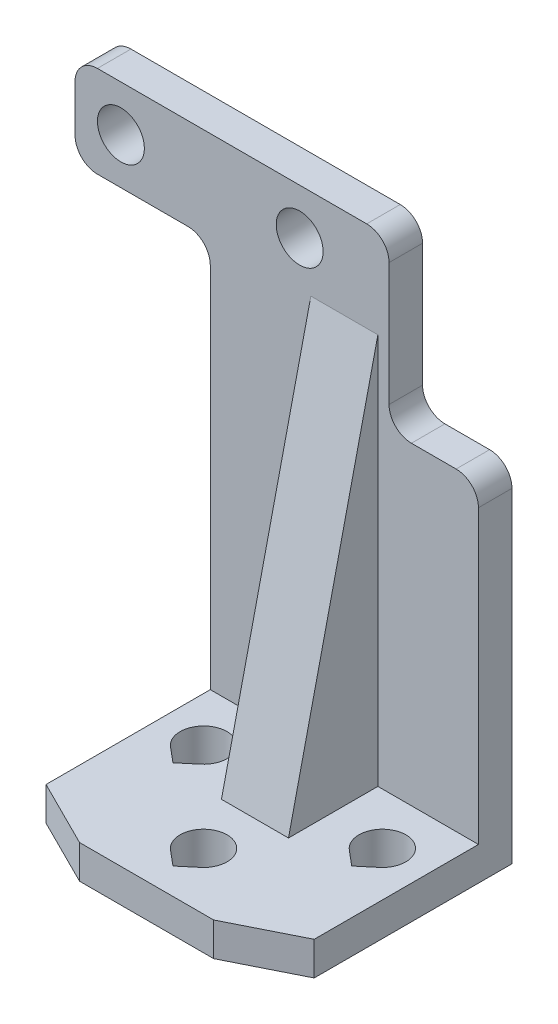
from build123d import *

# Parameters (mm, degrees)
SKETCH1_W           = 24
SKETCH1_H           = 17.7
BOSS_EXTRUDE1_DEPTH = 3
SKETCH2_R           = 2.1
BOSS_EXTRUDE2_DEPTH = 3
BOSS_EXTRUDE3_DEPTH = 3
CHAMFER1_SIZE       = 6
CHAMFER1_SIZE2      = 3
CHAMFER2_SIZE       = 3
CHAMFER2_SIZE2      = 6
FILLET1_R           = 2


with BuildPart() as part:
    # Sketch1 → Boss-Extrude1 (new body)
    with BuildSketch(Plane(origin=(0, 0, 0), x_dir=(1, 0, 0), z_dir=(0, 1, 0))):
        with Locations((0, -8.85)):
            Rectangle(SKETCH1_W, SKETCH1_H)
        with BuildLine():
            Line((-9.34985398, -6.208693331), (-8, -7.341355308))
            Line((-8, -7.341355308), (-6.65014602, -6.208693331))
            ThreePointArc((-6.65014602, -6.208693331), (-8, -2.5), (-9.34985398, -6.208693331))
        make_face(mode=Mode.SUBTRACT)
        with BuildLine():
            Line((6.65014602, -6.208693331), (8, -7.341355308))
            Line((8, -7.341355308), (9.34985398, -6.208693331))
            ThreePointArc((9.34985398, -6.208693331), (8, -2.5), (6.65014602, -6.208693331))
        make_face(mode=Mode.SUBTRACT)
        with BuildLine():
            Line((-1.34985398, -14.208693331), (0, -15.341355308))
            Line((0, -15.341355308), (1.34985398, -14.208693331))
            ThreePointArc((1.34985398, -14.208693331), (0, -10.5), (-1.34985398, -14.208693331))
        make_face(mode=Mode.SUBTRACT)
    extrude(amount=BOSS_EXTRUDE1_DEPTH)

    # Sketch2 → Boss-Extrude2 (add)
    with BuildSketch(Plane.XY):
        Polygon((12, 0), (-12, 0), (-12, 37.9), (-24.1, 37.9), (-24.1, 46.1), (-12, 46.1), (4, 46.1), (4, 31.1), (12, 31.1), align=None)
        with Locations((-20, 42)):
            Circle(SKETCH2_R, mode=Mode.SUBTRACT)
        with Locations((-4, 42)):
            Circle(SKETCH2_R, mode=Mode.SUBTRACT)
    extrude(amount=-BOSS_EXTRUDE2_DEPTH)

    # Sketch3 → Boss-Extrude3 (add, symmetric)
    with BuildSketch(Plane(origin=(0, 0, 0), x_dir=(0, 0, -1), z_dir=(1, 0, 0))):
        Polygon((0, 3), (-8, 3), (0, 38), align=None)
    extrude(amount=BOSS_EXTRUDE3_DEPTH, both=True)

    # Chamfer1
    chamfer1_edges = [part.edges().sort_by_distance(p)[0] for p in [
        (12, 1.5, 17.7),
    ]]
    chamfer1_side = [part.faces().sort_by_distance(p)[0] for p in [
        (0, 1.5, 17.7),
    ]]
    chamfer(chamfer1_edges, length=CHAMFER1_SIZE, length2=CHAMFER1_SIZE2, reference=chamfer1_side[0])

    # Chamfer2
    chamfer2_edges = [part.edges().sort_by_distance(p)[0] for p in [
        (-12, 1.5, 17.7),
    ]]
    chamfer2_side = [part.faces().sort_by_distance(p)[0] for p in [
        (-12, 1.5, 17.26815512),
    ]]
    chamfer(chamfer2_edges, length=CHAMFER2_SIZE, length2=CHAMFER2_SIZE2, reference=chamfer2_side[0])

    # Fillet1
    fillet1_edges = [part.edges().sort_by_distance(p)[0] for p in [
        (-12, 37.9, -1.5),
        (4, 31.1, -1.5),
        (12, 31.1, -1.5),
        (4, 46.1, -1.5),
        (-24.1, 46.1, -1.5),
        (-24.1, 37.9, -1.5),
    ]]
    fillet(fillet1_edges, radius=FILLET1_R)


solid = part.part
